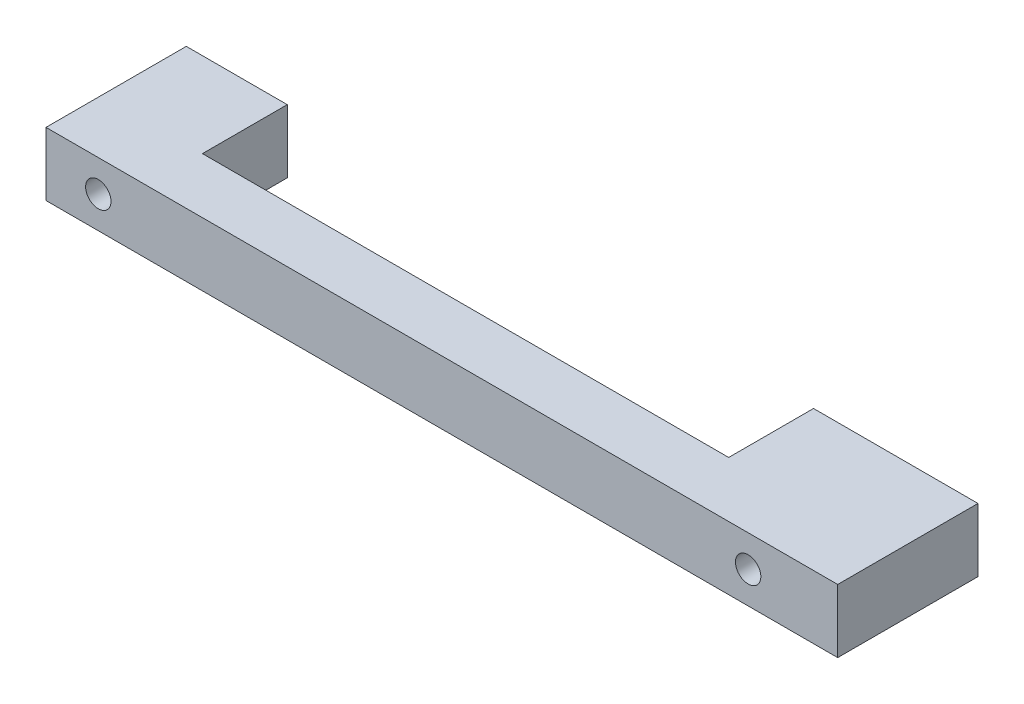
from build123d import *

# Parameters (mm, degrees)
SKETCH_1_W                               = 49.95
SKETCH_1_H                               = 4
REAR_INTERFACE_PLATE_DEPTH               = 8.851909566
SKETCH_2_R                               = 0.8
FRAME_2XD1P6_THROUGH_DEPTH               = 69.045140921
SKETCH_3_W                               = 33.203
SKETCH_3_H                               = 6.7
MERGED_INTERFACE_WINDOW_33P203X6P7_DEPTH = 4


with BuildPart() as part:
    # 草图1 → Rear_Interface_Plate (new body)
    with BuildSketch(Plane.XY):
        with Locations((24.675, 43.68)):
            Rectangle(SKETCH_1_W, SKETCH_1_H)
    extrude(amount=REAR_INTERFACE_PLATE_DEPTH)


with BuildPart() as part_1:
    # Stock_Z_Position: moved
    add(part.part.moved(Location((0, 0, 2.248090434))))

    # 草图2 → Frame_2xD1p6_Through (cut, through all)
    with BuildSketch(Plane.XY.offset(11.1)):
        with Locations((3, 43.68)):
            Circle(SKETCH_2_R)
        with Locations((44, 43.68)):
            Circle(SKETCH_2_R)
    extrude(amount=-FRAME_2XD1P6_THROUGH_DEPTH, mode=Mode.SUBTRACT)

    # 草图3 → Merged_Interface_Window_33p203x6p7 (cut)
    with BuildSketch(Plane(origin=(0, 45.68, 0), x_dir=(1, 0, 0), z_dir=(0, 1, 0))):
        with Locations((22.6715, -4.25)):
            Rectangle(SKETCH_3_W, SKETCH_3_H)
    extrude(amount=-MERGED_INTERFACE_WINDOW_33P203X6P7_DEPTH, mode=Mode.SUBTRACT)


solid = part_1.part
